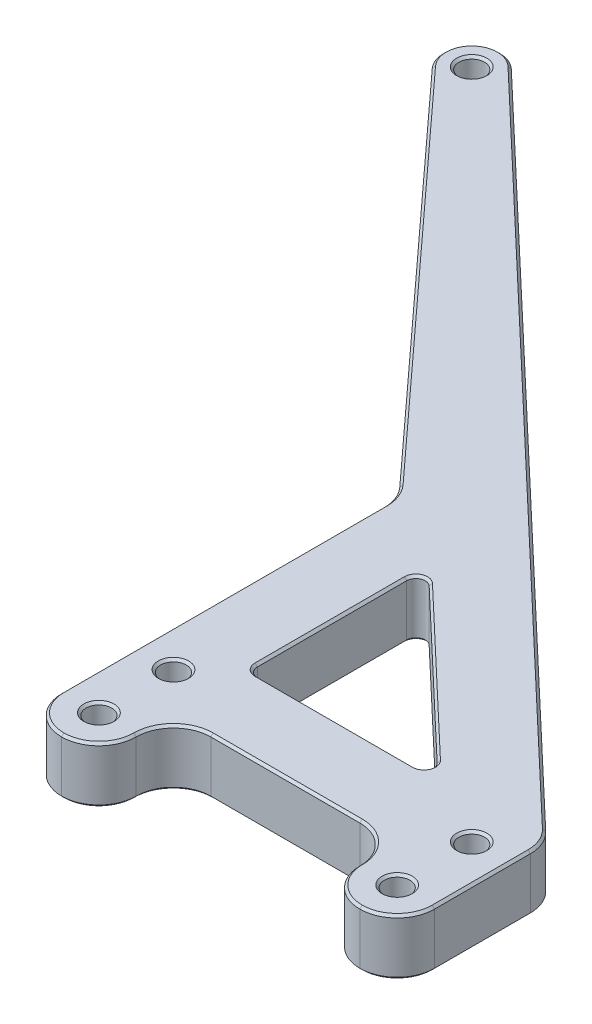
from build123d import *

# Parameters (mm, degrees)
SKETCH1_R           = 2.1828125
BOSS_EXTRUDE1_DEPTH = 9.525
CHAMFER1_SIZE       = 0.396875


with BuildPart() as part:
    # Sketch1 → Boss-Extrude1 (new body)
    with BuildSketch(Plane(origin=(0, 0, 0), x_dir=(1, 0, 0), z_dir=(0, 1, 0))):
        with BuildLine():
            Line((-6.35, 0), (-6.35, 54.968986339))
            ThreePointArc((-6.35, 54.968986339), (-6.780470884, 57.267175854), (-8.013519701, 59.253773662))
            Line((-8.013519701, 59.253773662), (-67.014860224, 123.786409508))
            ThreePointArc((-67.014860224, 123.786409508), (-66.836015353, 130.398883319), (-60.221355188, 130.454257437))
            Line((-60.221355188, 130.454257437), (55.171526417, 20.927889031))
            ThreePointArc((55.171526417, 20.927889031), (56.634453391, 18.828535178), (57.15, 16.322212447))
            Line((57.15, 16.322212447), (57.15, 0))
            ThreePointArc((57.15, 0), (55.290128061, -4.490128061), (50.8, -6.35))
            ThreePointArc((50.8, -6.35), (46.309797545, -4.490202455), (44.45, -0.000254))
            ThreePointArc((44.45, -0.000254), (42.590202455, 4.490202455), (38.100254, 6.35))
            Line((38.100254, 6.35), (12.699746, 6.35))
            ThreePointArc((12.699746, 6.35), (8.209797545, 4.490202455), (6.35, 0.000254))
            ThreePointArc((6.35, 0.000254), (4.490202455, -4.490202455), (0.000254, -6.35))
            ThreePointArc((0.000254, -6.35), (-4.490128061, -4.490128061), (-6.35, 0))
        make_face()
        Circle(SKETCH1_R, mode=Mode.SUBTRACT)
        with Locations((50.8, 12.7)):
            Circle(SKETCH1_R, mode=Mode.SUBTRACT)
        with Locations((-63.5, 127)):
            Circle(SKETCH1_R, mode=Mode.SUBTRACT)
        with Locations((0, 12.7)):
            Circle(SKETCH1_R, mode=Mode.SUBTRACT)
        with Locations((50.8, 0)):
            Circle(SKETCH1_R, mode=Mode.SUBTRACT)
        with BuildLine():
            Line((35.81658762, 21.788919146), (9.030381604, 47.213328586))
            ThreePointArc((9.030381604, 47.213328586), (7.310919317, 47.520522788), (6.35, 46.06190944))
            Line((6.35, 46.06190944), (6.35, 20.6375))
            ThreePointArc((6.35, 20.6375), (6.814967985, 19.514967985), (7.9375, 19.05))
            Line((7.9375, 19.05), (34.723706016, 19.05))
            ThreePointArc((34.723706016, 19.05), (36.198160855, 20.04916406), (35.81658762, 21.788919146))
        make_face(mode=Mode.SUBTRACT)
    extrude(amount=BOSS_EXTRUDE1_DEPTH)

    # Chamfer1
    chamfer1_edges = [part.edges().sort_by_distance(p)[0] for p in [
        (7.310919317, 9.525, -47.520522788),
        (6.35, 9.525, -33.34970472),
        (6.814967985, 9.525, -19.514967985),
        (21.330603008, 9.525, -19.05),
        (36.198160855, 9.525, -20.04916406),
        (22.423484612, 9.525, -34.501123866),
        (48.6171875, 9.525, 0),
        (-65.6828125, 9.525, -127),
        (-2.1828125, 9.525, 0),
        (46.309887349, 9.525, 4.490292258),
        (46.309887349, 9.525, 4.490292258),
        (42.59038206, 9.525, -4.490022844),
        (42.59038206, 9.525, -4.490022844),
        (25.4, 9.525, -6.35),
        (8.209797545, 9.525, -4.490202455),
        (4.49038206, 9.525, 4.490022844),
        (4.49038206, 9.525, 4.490022844),
        (-4.490038256, 9.525, 4.490217863),
        (-4.490038256, 9.525, 4.490217863),
        (-6.35, 9.525, -27.484493169),
        (-6.780470884, 9.525, -57.267175854),
        (-37.514189963, 9.525, -91.520091585),
        (-66.836015353, 9.525, -130.398883319),
        (-2.524914386, 9.525, -75.691073234),
        (56.634453391, 9.525, -18.828535178),
        (57.15, 9.525, -8.161106224),
        (55.290128061, 9.525, 4.490128061),
        (48.6171875, 9.525, -12.7),
        (-2.1828125, 9.525, -12.7),
        (21.330603008, 0, -19.05),
        (6.814967985, 0, -19.514967985),
        (6.35, 0, -33.34970472),
        (7.310919317, 0, -47.520522788),
        (22.423484612, 0, -34.501123866),
        (36.198160855, 0, -20.04916406),
        (57.15, 0, -8.161106224),
        (56.634453391, 0, -18.828535178),
        (-2.524914386, 0, -75.691073234),
        (-66.836015353, 0, -130.398883319),
        (-37.514189963, 0, -91.520091585),
        (-6.780470884, 0, -57.267175854),
        (-6.35, 0, -27.484493169),
        (-4.490038256, 0, 4.490217863),
        (-4.490038256, 0, 4.490217863),
        (4.49038206, 0, 4.490022844),
        (4.49038206, 0, 4.490022844),
        (8.209797545, 0, -4.490202455),
        (25.4, 0, -6.35),
        (42.59038206, 0, -4.490022844),
        (42.59038206, 0, -4.490022844),
        (46.309887349, 0, 4.490292258),
        (46.309887349, 0, 4.490292258),
        (55.290128061, 0, 4.490128061),
        (-65.6828125, 0, -127),
        (-2.1828125, 0, 0),
        (48.6171875, 0, -12.7),
        (-2.1828125, 0, -12.7),
        (48.6171875, 0, 0),
    ]]
    chamfer(chamfer1_edges, length=CHAMFER1_SIZE)


solid = part.part
